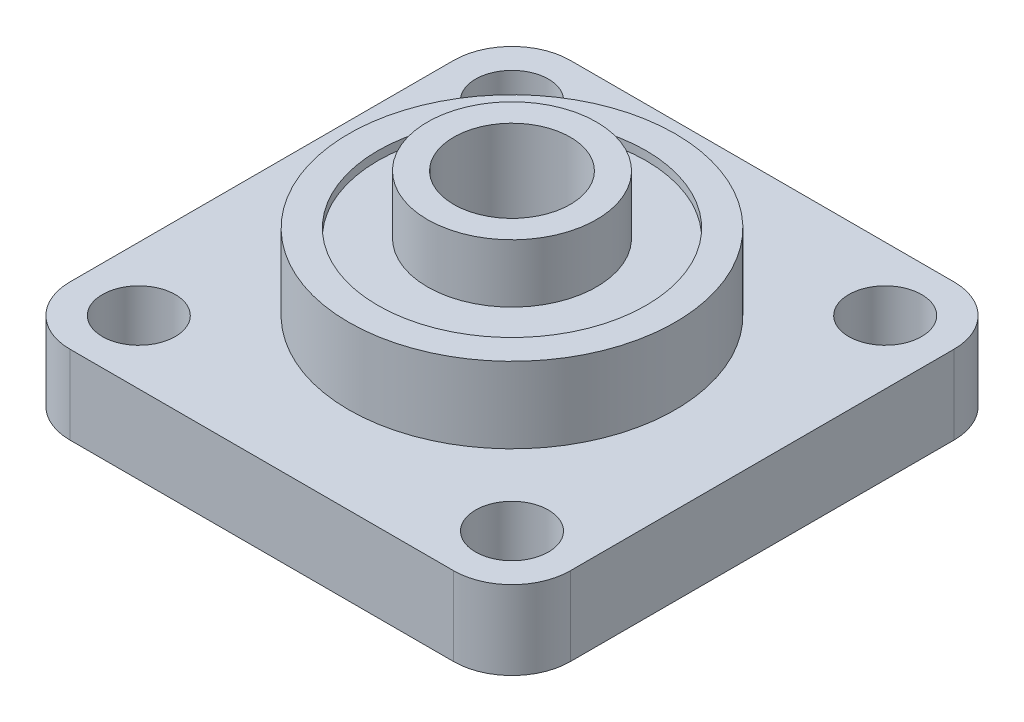
from build123d import *

# Parameters (mm, degrees)
SKETCH_2_W          = 85.8
SKETCH_2_H          = 85.8
SKETCH_2_R          = 6.25
EXTRUDE_1_DEPTH     = 13.5
FILLET_1_R          = 10
SKETCH_3_R          = 10
CUT_EXTRUDE_1_DEPTH = 65.366683929


with BuildPart() as part:
    # 草图1 → 旋转1 (revolve)
    with BuildSketch(Plane.XY):
        Polygon((10, 30), (14.5, 30), (14.5, 20), (23, 20), (23, 21.5), (28, 21.5), (28, 3.5), (14.5, 3.5), (14.5, 0), (10, 0), align=None)
    revolve(axis=Axis((0, 50.942477876, 0), (0, -1, 0)))

    # 草图2 → 凸台-拉伸1 (add)
    with BuildSketch(Plane(origin=(0, -5, 0), x_dir=(1, 0, 0), z_dir=(0, 1, 0))):
        Rectangle(SKETCH_2_W, SKETCH_2_H)
        with Locations((-32, 32)):
            Circle(SKETCH_2_R, mode=Mode.SUBTRACT)
        with Locations((32, 32)):
            Circle(SKETCH_2_R, mode=Mode.SUBTRACT)
        with Locations((32, -32)):
            Circle(SKETCH_2_R, mode=Mode.SUBTRACT)
        with Locations((-32, -32)):
            Circle(SKETCH_2_R, mode=Mode.SUBTRACT)
    extrude(amount=EXTRUDE_1_DEPTH)

    # 圆角1
    fillet_1_edges = [part.edges().sort_by_distance(p)[0] for p in [
        (42.9, 1.75, 42.9),
        (42.9, 1.75, -42.9),
        (-42.9, 1.75, -42.9),
        (-42.9, 1.75, 42.9),
    ]]
    fillet(fillet_1_edges, radius=FILLET_1_R)

    # 草图3 → 切除-拉伸1 (cut, through all)
    with BuildSketch(Plane(origin=(0, 8.5, 0), x_dir=(1, 0, 0), z_dir=(0, 1, 0))):
        Circle(SKETCH_3_R)
    extrude(amount=-CUT_EXTRUDE_1_DEPTH, mode=Mode.SUBTRACT)


solid = part.part
